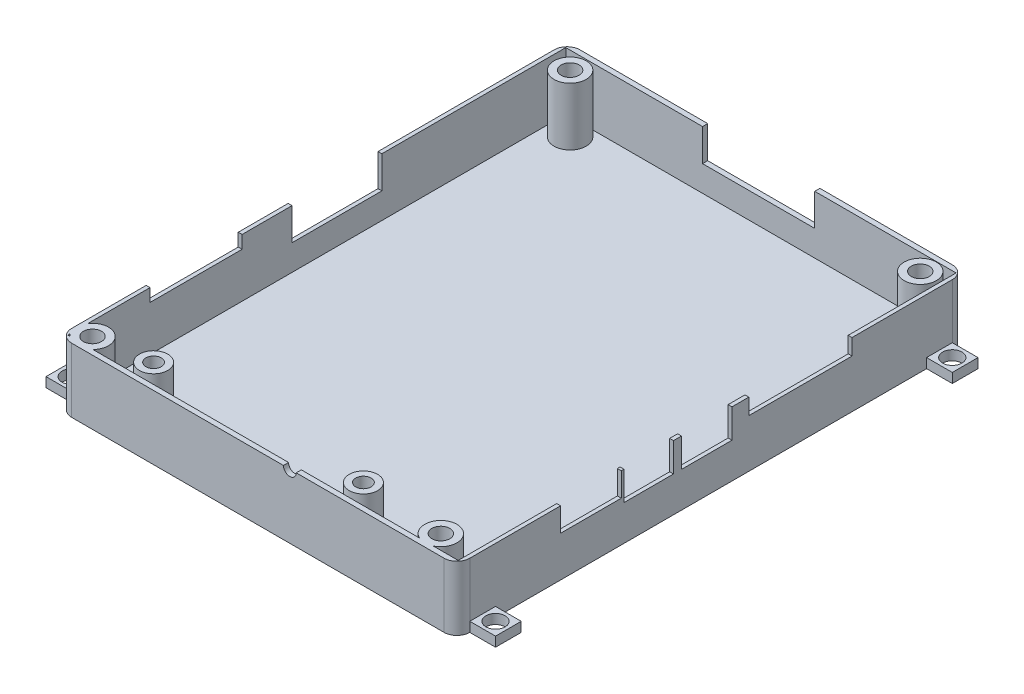
from build123d import *

# Parameters (mm, degrees)
SKETCH1_W            = 60.725
SKETCH1_H            = 77.455
SKETCH1_R            = 1.4
BOSS_EXTRUDE8_DEPTH  = 1
SKETCH8_R            = 2.5
SKETCH8_R_2          = 1.4
SKETCH8_R_3          = 2.2
SKETCH8_R_4          = 1.2
BOSS_EXTRUDE9_DEPTH  = 10
SKETCH7_W            = 61.925
SKETCH7_H            = 79.055
BOSS_EXTRUDE10_DEPTH = 10
SKETCH10_W           = 17.445
SKETCH10_H           = 5
CUT_EXTRUDE1_DEPTH   = 10
SKETCH12_W           = 13.97
SKETCH12_H           = 5
SKETCH12_W_2         = 14.326
SKETCH12_H_2         = 2
CUT_EXTRUDE3_DEPTH   = 10
SKETCH11_W           = 16.06086727
SKETCH11_H           = 2.5
SKETCH11_W_2         = 9.443
SKETCH11_H_2         = 3.7
SKETCH11_W_3         = 7.711
SKETCH11_H_3         = 4.5
SKETCH11_W_4         = 7.86
CUT_EXTRUDE4_DEPTH   = 10
CUT_EXTRUDE6_DEPTH   = 10
FILLET5_R            = 2
FILLET6_R            = 2
SKETCH18_R           = 2
CUT_EXTRUDE10_DEPTH  = 2
SKETCH19_W           = 4
SKETCH19_H           = 1.5
BOSS_EXTRUDE12_DEPTH = 4
SKETCH20_W           = 4
SKETCH20_H           = 1.5
BOSS_EXTRUDE13_DEPTH = 4
SKETCH21_R           = 1.5
CUT_EXTRUDE11_DEPTH  = 4


with BuildPart() as part:
    # Sketch1 → Boss-Extrude8 (new body)
    with BuildSketch(Plane(origin=(0, 0, 0), x_dir=(1, 0, 0), z_dir=(0, 1, 0))):
        with Locations((26.9875, -36.0275)):
            Rectangle(SKETCH1_W, SKETCH1_H)
        with Locations((-1.272792206, -73.027792206)):
            Circle(SKETCH1_R, mode=Mode.SUBTRACT)
        with Locations((52.378713574, -72.4915)):
            Circle(SKETCH1_R, mode=Mode.SUBTRACT)
        Circle(SKETCH1_R, mode=Mode.SUBTRACT)
        with Locations((54.342, 0.127)):
            Circle(SKETCH1_R, mode=Mode.SUBTRACT)
    extrude(amount=BOSS_EXTRUDE8_DEPTH)

    # Sketch8 → Boss-Extrude9 (add)
    # profile 1 of 6: a face of its own
    with BuildSketch(Plane(origin=(0, 0, 0), x_dir=(1, 0, 0), z_dir=(0, 1, 0))):
        Circle(SKETCH8_R)
        Circle(SKETCH8_R_2, mode=Mode.SUBTRACT)
    # profile 2 of 6: a face of its own
    with BuildSketch(Plane(origin=(0, 0, 0), x_dir=(1, 0, 0), z_dir=(0, 1, 0))):
        with Locations((54.342, 0.127)):
            Circle(SKETCH8_R)
        with Locations((54.342, 0.127)):
            Circle(SKETCH8_R_2, mode=Mode.SUBTRACT)
    # profile 3 of 6: a face of its own
    with BuildSketch(Plane(origin=(0, 0, 0), x_dir=(1, 0, 0), z_dir=(0, 1, 0))):
        with Locations((52.378713574, -72.4915)):
            Circle(SKETCH8_R)
        with Locations((52.378713574, -72.4915)):
            Circle(SKETCH8_R_2, mode=Mode.SUBTRACT)
    # profile 4 of 6: a face of its own
    with BuildSketch(Plane(origin=(0, 0, 0), x_dir=(1, 0, 0), z_dir=(0, 1, 0))):
        with Locations((39.475, -71.628)):
            Circle(SKETCH8_R_3)
        with Locations((39.475, -71.628)):
            Circle(SKETCH8_R_4, mode=Mode.SUBTRACT)
    # profile 5 of 6: a face of its own
    with BuildSketch(Plane(origin=(0, 0, 0), x_dir=(1, 0, 0), z_dir=(0, 1, 0))):
        with Locations((6.963, -71.755)):
            Circle(SKETCH8_R_3)
        with Locations((6.963, -71.755)):
            Circle(SKETCH8_R_4, mode=Mode.SUBTRACT)
    # profile 6 of 6: a face of its own
    with BuildSketch(Plane(origin=(0, 0, 0), x_dir=(1, 0, 0), z_dir=(0, 1, 0))):
        with Locations((-1.272792206, -73.027792206)):
            Circle(SKETCH8_R)
        with Locations((-1.272792206, -73.027792206)):
            Circle(SKETCH8_R_2, mode=Mode.SUBTRACT)
    extrude(amount=BOSS_EXTRUDE9_DEPTH)

    # Sketch7 → Boss-Extrude10 (add)
    with BuildSketch(Plane(origin=(0, 0, 0), x_dir=(1, 0, 0), z_dir=(0, 1, 0))):
        with Locations((26.9875, -36.0275)):
            Rectangle(SKETCH7_W, SKETCH7_H)
        Polygon((-3.175, 2.7), (57.15, 2.7), (57.35, 2.7), (57.35, -74.755), (57.15, -74.755), (-3.175, -74.755), (-3.375, -74.755), (-3.375, 2.7), align=None, mode=Mode.SUBTRACT)
    extrude(amount=BOSS_EXTRUDE10_DEPTH)

    # Sketch10 → Cut-Extrude1 (cut)
    with BuildSketch(Plane(origin=(0, 0, -3.5), x_dir=(-1, 0, 0), z_dir=(0, 0, -1))):
        with Locations((-26.6275, 7.5)):
            Rectangle(SKETCH10_W, SKETCH10_H)
    extrude(amount=-CUT_EXTRUDE1_DEPTH, mode=Mode.SUBTRACT)

    # Sketch12 → Cut-Extrude3 (cut)
    with BuildSketch(Plane.ZY.offset(3.975)):
        with Locations((32.893, 7.5)):
            Rectangle(SKETCH12_W, SKETCH12_H)
        with Locations((54.813, 9)):
            Rectangle(SKETCH12_W_2, SKETCH12_H_2)
    extrude(amount=-CUT_EXTRUDE3_DEPTH, mode=Mode.SUBTRACT)

    # Sketch11 → Cut-Extrude4 (cut)
    with BuildSketch(Plane(origin=(57.95, 0, 0), x_dir=(0, 0, -1), z_dir=(1, 0, 0))):
        with Locations((-22.124433635, 8.75)):
            Rectangle(SKETCH11_W, SKETCH11_H)
        with Locations((-54.7115, 8.15)):
            Rectangle(SKETCH11_W_2, SKETCH11_H_2)
        with Locations((-45.7255, 7.75)):
            Rectangle(SKETCH11_W_3, SKETCH11_H_3)
        with Locations((-36.7, 7.75)):
            Rectangle(SKETCH11_W_4, SKETCH11_H_3)
    extrude(amount=-CUT_EXTRUDE4_DEPTH, mode=Mode.SUBTRACT)

    # Sketch14 → Cut-Extrude6 (cut)
    with BuildSketch(Plane.XY.offset(75.555)):
        with BuildLine():
            Line((30.954783784, 10), (32.945216216, 10))
            ThreePointArc((32.945216216, 10), (31.95, 9.004783784), (30.954783784, 10))
        make_face()
    extrude(amount=-CUT_EXTRUDE6_DEPTH, mode=Mode.SUBTRACT)

    # Fillet5
    fillet5_edges = [part.edges().sort_by_distance(p)[0] for p in [
        (-3.975, 5, -3.5),
    ]]
    fillet(fillet5_edges, radius=FILLET5_R)

    # Fillet6
    fillet6_edges = [part.edges().sort_by_distance(p)[0] for p in [
        (-3.975, 5, 75.555),
        (57.95, 5, 75.555),
        (57.95, 5, -3.5),
    ]]
    fillet(fillet6_edges, radius=FILLET6_R)

    # Sketch18 → Cut-Extrude10 (cut)
    with BuildSketch(Plane.XZ):
        Circle(SKETCH18_R)
        with Locations((54.342, -0.127)):
            Circle(SKETCH18_R)
        with Locations((52.378713574, 72.4915)):
            Circle(SKETCH18_R)
        with Locations((-1.272792206, 73.027792206)):
            Circle(SKETCH18_R)
    extrude(amount=-CUT_EXTRUDE10_DEPTH, mode=Mode.SUBTRACT)

    # Sketch19 → Boss-Extrude12 (add)
    with BuildSketch(Plane(origin=(57.95, 0, 0), x_dir=(0, 0, -1), z_dir=(1, 0, 0))):
        with Locations((-71.555, 0.75)):
            Rectangle(SKETCH19_W, SKETCH19_H)
        with Locations((-0.5, 0.75)):
            Rectangle(SKETCH19_W, SKETCH19_H)
    extrude(amount=BOSS_EXTRUDE12_DEPTH)

    # Sketch20 → Boss-Extrude13 (add)
    with BuildSketch(Plane.ZY.offset(3.975)):
        with Locations((0.5, 0.75)):
            Rectangle(SKETCH20_W, SKETCH20_H)
        with Locations((71.555, 0.75)):
            Rectangle(SKETCH20_W, SKETCH20_H)
    extrude(amount=BOSS_EXTRUDE13_DEPTH)

    # Sketch21 → Cut-Extrude11 (cut)
    with BuildSketch(Plane(origin=(0, 1.5, 0), x_dir=(1, 0, 0), z_dir=(0, 1, 0))):
        with Locations((-5.975, -0.5)):
            Circle(SKETCH21_R)
        with Locations((-5.975, -71.555)):
            Circle(SKETCH21_R)
        with Locations((59.95, -0.5)):
            Circle(SKETCH21_R)
        with Locations((59.95, -71.555)):
            Circle(SKETCH21_R)
    extrude(amount=-CUT_EXTRUDE11_DEPTH, mode=Mode.SUBTRACT)


solid = part.part
